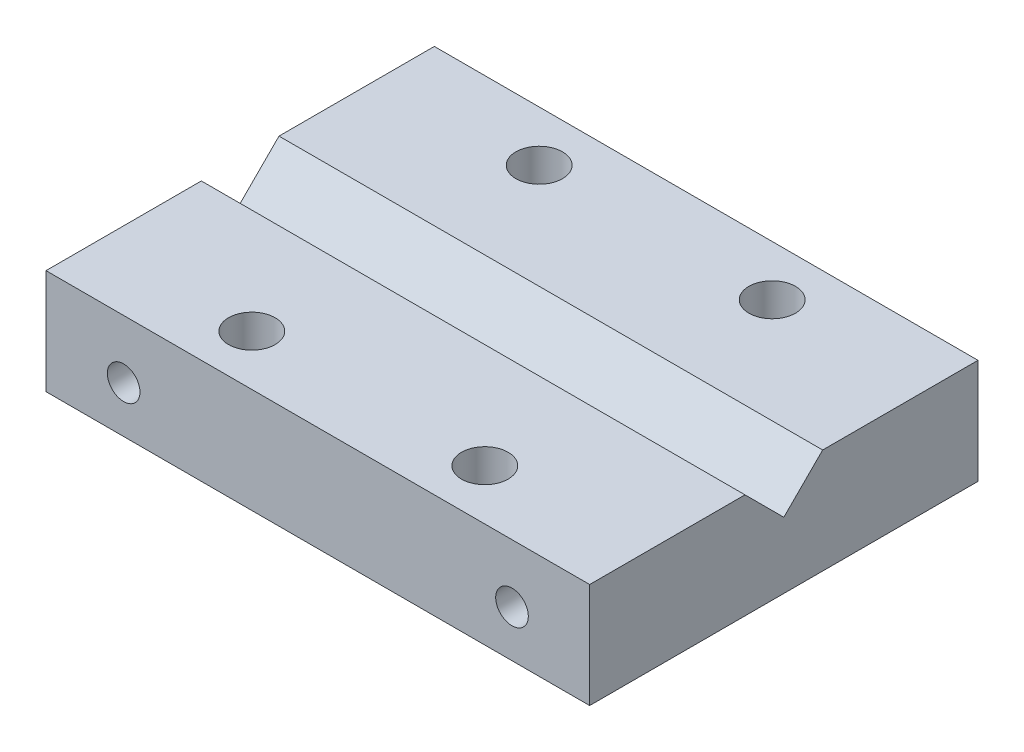
from build123d import *

# Parameters (mm, degrees)
SKETCH1_W             = 70
SKETCH1_H             = 50
BOSS_EXTRUDE1_DEPTH   = 13.5
CUT_EXTRUDE1_DEPTH    = 78.5
SKETCH6_R             = 3
CUT_EXTRUDE2_DEPTH    = 200
M4_TAPPED_HOLE1_D     = 3.3
M4_TAPPED_HOLE1_DEPTH = 8
M4_TAPPED_HOLE1_TIP   = 0.991420021
M5_TAPPED_HOLE1_D     = 4.2
M5_TAPPED_HOLE1_DEPTH = 15
M5_TAPPED_HOLE1_TIP   = 1.2618073


# Read off the part's stored shape, not the designer's step: M5 Tapped Hole2
with BuildPart() as part:
    # Sketch1 → Boss-Extrude1 (new body)
    with BuildSketch(Plane(origin=(0, 0, 0), x_dir=(1, 0, 0), z_dir=(0, 1, 0))):
        with Locations((2.798036466, 2.959326788)):
            Rectangle(SKETCH1_W, SKETCH1_H)
    extrude(amount=BOSS_EXTRUDE1_DEPTH)

    # Sketch3 → Cut-Extrude1 (cut)
    with BuildSketch(Plane.ZY.offset(32.201963534)):
        Polygon((-2.959326788, 8.5), (-7.959326788, 13.5), (2.040673212, 13.5), align=None)
    extrude(amount=-CUT_EXTRUDE1_DEPTH, mode=Mode.SUBTRACT)

    # Sketch6 → Cut-Extrude2 (cut)
    with BuildSketch(Plane(origin=(0, 0, 0), x_dir=(1, 0, 0), z_dir=(0, 1, 0))):
        with Locations(Location((-12.201963534, -15.540673212, 0), (0, 0, 270))):
            Circle(SKETCH6_R)
        with Locations(Location((17.798036466, -15.540673212, 0), (0, 0, 270))):
            Circle(SKETCH6_R)
        with Locations(Location((-12.201963534, 21.459326788, 0), (0, 0, 270))):
            Circle(SKETCH6_R)
        with Locations(Location((17.798036466, 21.459326788, 0), (0, 0, 270))):
            Circle(SKETCH6_R)
    extrude(amount=CUT_EXTRUDE2_DEPTH, mode=Mode.SUBTRACT)

    # M4 Tapped Hole1
    with Locations(Plane(origin=(0, 0, 0), x_dir=(-1, 0, 0), z_dir=(0, -1, 0))):
        with Locations((-2.798036466, -15.540673212), (-2.798036466, 21.459326788)):
            Hole(M4_TAPPED_HOLE1_D / 2, depth=M4_TAPPED_HOLE1_DEPTH)
            with Locations((0, 0, -(M4_TAPPED_HOLE1_DEPTH + M4_TAPPED_HOLE1_TIP / 2))):  # 118° drill point
                Cone(0, M4_TAPPED_HOLE1_D / 2, M4_TAPPED_HOLE1_TIP, mode=Mode.SUBTRACT)

    # M5 Tapped Hole1
    with Locations(Plane(origin=(0, 0, -27.959326788), x_dir=(-1, 0, 0), z_dir=(0, 0, -1))):
        with Locations((-27.798036466, 6), (22.201963534, 6)):
            Hole(M5_TAPPED_HOLE1_D / 2, depth=M5_TAPPED_HOLE1_DEPTH)
            with Locations((0, 0, -(M5_TAPPED_HOLE1_DEPTH + M5_TAPPED_HOLE1_TIP / 2))):  # 118° drill point
                Cone(0, M5_TAPPED_HOLE1_D / 2, M5_TAPPED_HOLE1_TIP, mode=Mode.SUBTRACT)

    # M5 Tapped Hole2 outline → M5 Tapped Hole2 (revolve, cut)
    with BuildSketch(Plane(origin=(-22.201963534, 6, 0), x_dir=(1, 0, 0), z_dir=(0, -1, 0))):
        Polygon((0, 5.778865912), (2.1, 7.040673212), (2.1, 22.040673212), (0, 22.040673212), align=None)
    revolve(axis=Axis((-22.201963534, 6, 0), (0, 0, 1)), mode=Mode.SUBTRACT)

    # M5 Tapped Hole2 2 outline → M5 Tapped Hole2 2 (revolve, cut)
    with BuildSketch(Plane(origin=(27.798036466, 6, 0), x_dir=(1, 0, 0), z_dir=(0, -1, 0))):
        Polygon((0, 5.778865912), (2.1, 7.040673212), (2.1, 22.040673212), (0, 22.040673212), align=None)
    revolve(axis=Axis((27.798036466, 6, 0), (0, 0, 1)), mode=Mode.SUBTRACT)


solid = part.part
